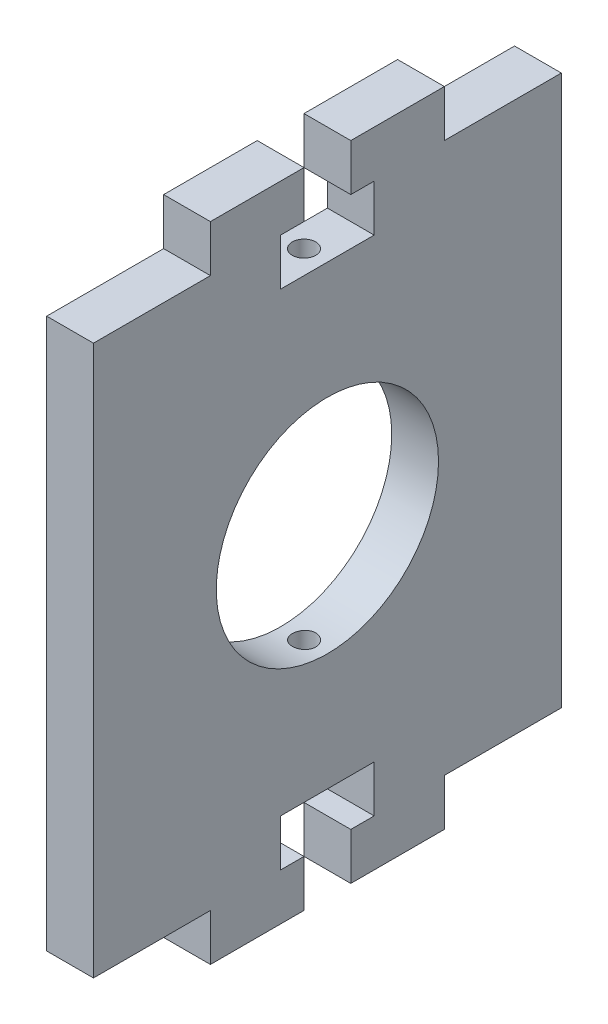
from build123d import *

# Parameters (mm, degrees)
SKETCH_1_R             = 9.5
SM_BASE_FLANGE_1_DEPTH = 4
SKETCH_6_R             = 1
CUT_EXTRUDE_1_DEPTH    = 69.124885321


# Sheet-metal steps are written as plain solids
with BuildPart() as part:
    # Sketch 1 → Базовая кромка1 (new body)
    with BuildSketch(Plane(origin=(0, 0, 0), x_dir=(0, 0, -1), z_dir=(1, 0, 0))):
        Polygon((30, -47), (40, -47), (40, 0), (30, 0), (30, 4), (22, 4), (22, 0), (24, 0), (24, -4), (16, -4), (16, 0), (18, 0), (18, 4), (10, 4), (10, 0), (0, 0), (0, -47), (10, -47), (10, -51), (18, -51), (18, -47), (16, -47), (16, -43), (24, -43), (24, -47), (22, -47), (22, -51), (30, -51), align=None)
        with Locations((20, -23.5)):
            Circle(SKETCH_1_R, mode=Mode.SUBTRACT)
    extrude(amount=-SM_BASE_FLANGE_1_DEPTH)

    # Эскиз6 → Вырез-Вытянуть1 (cut, through all)
    with BuildSketch(Plane(origin=(0, 4, 0), x_dir=(1, 0, 0), z_dir=(0, 1, 0))):
        with Locations(Location((-2, 20, 0), (0, 0, 270))):
            Circle(SKETCH_6_R)
    extrude(amount=-CUT_EXTRUDE_1_DEPTH, mode=Mode.SUBTRACT)


solid = part.part
